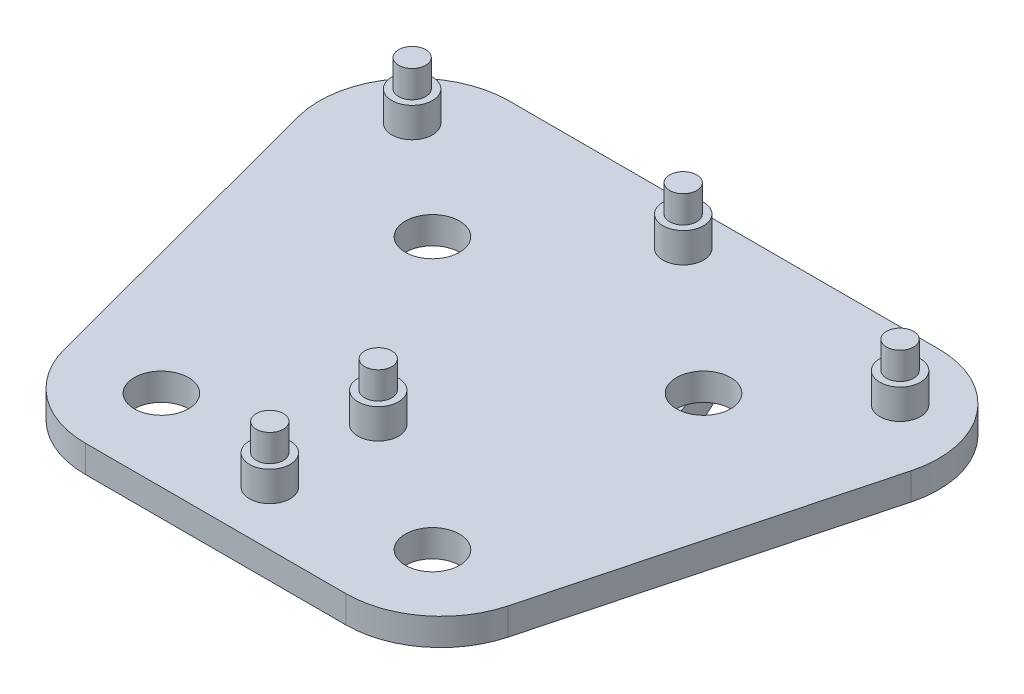
from build123d import *

# Parameters (mm, degrees)
SKETCH1_R               = 2
BOSS_EXTRUDE1_DEPTH     = 2
FILLET1_R               = 7
SKETCH2_R               = 1.5
BOSS_EXTRUDE2_DEPTH     = 2.2
SKETCH3_R               = 1
BOSS_EXTRUDE3_DEPTH     = 2
SKETCH4_W               = 2
SKETCH4_H               = 15
BOSS_EXTRUDE4_DEPTH     = 7
FILLET3_START           = -3
FILLET3_DEPTH           = 6
FILLET3_2_DEPTH         = 2
FILLET3_START_2         = 1
FILLET3_3_DEPTH         = 2
CUT_EXTRUDE1_DEPTH      = 47.08088663
CUT_EXTRUDE1_DEPTH_BACK = 47.08088663
SKETCH5_R               = 2


with BuildPart() as part:
    # Sketch1 → Boss-Extrude1 (new body)
    with BuildSketch(Plane(origin=(0, 0, 0), x_dir=(1, 0, 0), z_dir=(0, 1, 0))):
        Polygon((-15, 0), (15, 0), (24.948794511, 37.5), (-24.948794511, 37.5), align=None)
        with Locations(Location((10, 26, 0), (0, 0, 270))):
            Circle(SKETCH1_R, mode=Mode.SUBTRACT)
        with Locations(Location((10, 6, 0), (0, 0, 270))):
            Circle(SKETCH1_R, mode=Mode.SUBTRACT)
        with Locations(Location((-10, 6, 0), (0, 0, 90))):
            Circle(SKETCH1_R, mode=Mode.SUBTRACT)
        with Locations(Location((-10, 26, 0), (0, 0, 90))):
            Circle(SKETCH1_R, mode=Mode.SUBTRACT)
    extrude(amount=BOSS_EXTRUDE1_DEPTH)

    # Fillet1
    fillet1_edges = [part.edges().sort_by_distance(p)[0] for p in [
        (-24.948794511, 1, -37.5),
        (24.948794511, 1, -37.5),
        (15, 1, 0),
        (-15, 1, 0),
    ]]
    fillet(fillet1_edges, radius=FILLET1_R)

    # Sketch2 → Boss-Extrude2 (add)
    with BuildSketch(Plane(origin=(0, 2, 0), x_dir=(1, 0, 0), z_dir=(0, 1, 0))):
        with Locations(Location((0, 34.5, 0), (0, 0, 270))):
            Circle(SKETCH2_R)
        with Locations(Location((18, 32.5, 0), (0, 0, 270))):
            Circle(SKETCH2_R)
        with Locations(Location((0, 4, 0), (0, 0, 270))):
            Circle(SKETCH2_R)
        with Locations(Location((0, 12, 0), (0, 0, 270))):
            Circle(SKETCH2_R)
        with Locations(Location((-18, 32.5, 0), (0, 0, 90))):
            Circle(SKETCH2_R)
    extrude(amount=BOSS_EXTRUDE2_DEPTH)

    # Sketch3 → Boss-Extrude3 (add)
    with BuildSketch(Plane(origin=(0, 4.2, 0), x_dir=(1, 0, 0), z_dir=(0, 1, 0))):
        with Locations(Location((-18, 32.5, 0), (0, 0, 270))):
            Circle(SKETCH3_R)
        with Locations(Location((0, 34.5, 0), (0, 0, 270))):
            Circle(SKETCH3_R)
        with Locations(Location((18, 32.5, 0), (0, 0, 270))):
            Circle(SKETCH3_R)
        with Locations(Location((0, 12, 0), (0, 0, 270))):
            Circle(SKETCH3_R)
        with Locations(Location((0, 4, 0), (0, 0, 270))):
            Circle(SKETCH3_R)
    extrude(amount=BOSS_EXTRUDE3_DEPTH)

    # Sketch4 → Boss-Extrude4 (add)
    with BuildSketch(Plane.XZ):
        with Locations((-2, -27)):
            Rectangle(SKETCH4_W, SKETCH4_H)
        with Locations((2, -27)):
            Rectangle(SKETCH4_W, SKETCH4_H)
    extrude(amount=BOSS_EXTRUDE4_DEPTH)

    # Fillet3: read off the stored shape, not the designer's step
    # Fillet3 outline → Fillet3 (cut)
    with BuildSketch(Plane.YZ.offset(FILLET3_START)):
        with BuildLine():
            Line((-7, -34.5), (-4, -34.5))
            ThreePointArc((-4, -34.5), (-6.121320344, -33.621320344), (-7, -31.5))
            Line((-7, -31.5), (-7, -34.5))
        make_face()
        with BuildLine():
            Line((-7, -19.5), (-7, -22.5))
            ThreePointArc((-7, -22.5), (-6.121320344, -20.378679656), (-4, -19.5))
            Line((-4, -19.5), (-7, -19.5))
        make_face()
    extrude(amount=FILLET3_DEPTH, mode=Mode.SUBTRACT)

    # Fillet3 2 outline → Fillet3 2 (add)
    with BuildSketch(Plane.YZ.offset(FILLET3_START)):
        with BuildLine():
            Line((0, -34.5), (-3, -34.5))
            ThreePointArc((-3, -34.5), (-0.878679656, -35.378679656), (0, -37.5))
            Line((0, -37.5), (0, -34.5))
        make_face()
        with BuildLine():
            Line((-3, -19.5), (0, -19.5))
            Line((0, -19.5), (0, -16.5))
            ThreePointArc((0, -16.5), (-0.878679656, -18.621320344), (-3, -19.5))
        make_face()
    extrude(amount=FILLET3_2_DEPTH)

    # Fillet3 3 outline → Fillet3 3 (add)
    with BuildSketch(Plane.YZ.offset(FILLET3_START_2)):
        with BuildLine():
            Line((0, -34.5), (-3, -34.5))
            ThreePointArc((-3, -34.5), (-0.878679656, -35.378679656), (0, -37.5))
            Line((0, -37.5), (0, -34.5))
        make_face()
        with BuildLine():
            Line((-3, -19.5), (0, -19.5))
            Line((0, -19.5), (0, -16.5))
            ThreePointArc((0, -16.5), (-0.878679656, -18.621320344), (-3, -19.5))
        make_face()
    extrude(amount=FILLET3_3_DEPTH)

    # Sketch5 → Cut-Extrude1 (cut, two sides: drawn at the far end of the back side and taken through both)
    with BuildSketch(Plane.ZY.offset(3).offset(-CUT_EXTRUDE1_DEPTH_BACK)):
        with Locations((-30.5, -3.5)):
            Circle(SKETCH5_R)
        with Locations((-23.5, -3.5)):
            Circle(SKETCH5_R)
    extrude(amount=CUT_EXTRUDE1_DEPTH + CUT_EXTRUDE1_DEPTH_BACK, mode=Mode.SUBTRACT)


solid = part.part
